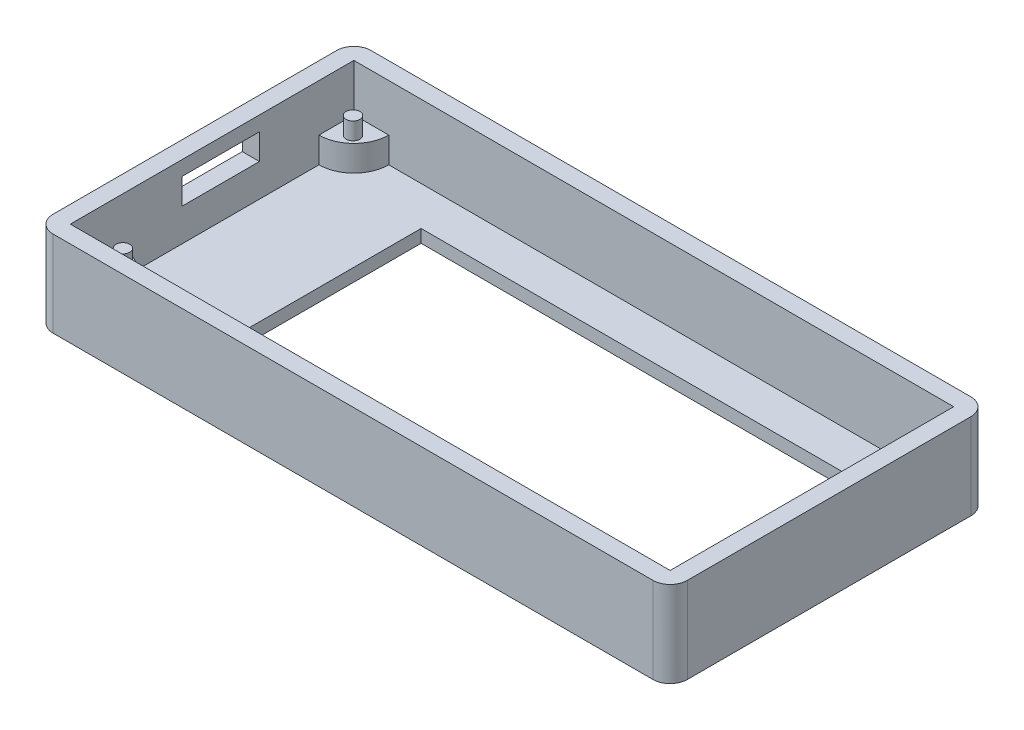
from build123d import *

# Parameters (mm, degrees)
EXTRUDE_1_DEPTH     = 1.5
CUT_EXTRUDE_2_REACH = 41.105
SKETCH_1_6_W        = 49.995
SKETCH_1_6_H        = 24.956
EXTRUDE_1_2_DEPTH   = 10
FILLET_1_R          = 2
EXTRUDE_2_DEPTH     = 3
SKETCH_3_R          = 0.8
EXTRUDE_3_DEPTH     = 2
CUT_EXTRUDE_3_REACH = 77.124
SKETCH_4_W          = 9
SKETCH_4_H          = 3


with BuildPart() as part:
    # 草图1 → Extrude 1 (new body)
    with BuildSketch(Plane(origin=(0, 0, 0), x_dir=(1, 0, 0), z_dir=(0, 1, 0))):
        Polygon((-34.925, 15.494), (34.925, 15.494), (34.925, -15.494), (34.925, -17.526), (-34.925, -17.526), (-34.925, -15.494), align=None)
    extrude(amount=EXTRUDE_1_DEPTH)

    # 草图1<6> → 切除-拉伸2 (cut, up to next)
    with BuildSketch(Plane(origin=(0, 0, 0), x_dir=(1, 0, 0), z_dir=(0, 1, 0)), mode=Mode.PRIVATE) as cut_extrude_2_sk1:
        with Locations((2.4365, -1.516)):
            Rectangle(SKETCH_1_6_W, SKETCH_1_6_H)
    cut_extrude_2_tool1 = extrude(cut_extrude_2_sk1.sketch, amount=CUT_EXTRUDE_2_REACH, mode=Mode.PRIVATE) & part.part
    add(cut_extrude_2_tool1.solids().sort_by_distance((2.4365, 0, 1.516))[0], mode=Mode.SUBTRACT)



with BuildPart() as body_2:
    # 草图1<7> → Extrude 1 2 (new body)
    with BuildSketch(Plane(origin=(0, 0, 0), x_dir=(1, 0, 0), z_dir=(0, 1, 0))):
        Polygon((36.925, -19.526), (-36.925, -19.526), (-36.925, -15.494), (-36.925, 17.494), (36.925, 17.494), (36.925, -15.494), align=None)
        Polygon((34.925, -17.526), (-34.925, -17.526), (-34.925, -15.494), (-34.925, 15.494), (34.925, 15.494), (34.925, -15.494), align=None, mode=Mode.SUBTRACT)
    extrude(amount=EXTRUDE_1_2_DEPTH)

    # 圆角1
    fillet_1_edges = [body_2.edges().sort_by_distance(p)[0] for p in [
        (36.925, 5, -17.494),
        (36.925, 5, 19.526),
        (-36.925, 5, 19.526),
        (-36.925, 5, -17.494),
    ]]
    fillet(fillet_1_edges, radius=FILLET_1_R)


with BuildPart() as part_1:
    add(part.part)

    add(body_2.part)  # 凸台-拉伸2 merges body 2
    # 草图2 → 凸台-拉伸2 (add)
    with BuildSketch(Plane(origin=(0, 1.5, 0), x_dir=(1, 0, 0), z_dir=(0, 1, 0))):
        with BuildLine():
            ThreePointArc((-31.405472759, -17.526), (-31.405472759, -13.462), (-34.925, -11.43))
            Line((-34.925, -11.43), (-34.925, -17.526))
            Line((-34.925, -17.526), (-31.405472759, -17.526))
        make_face()
        with BuildLine():
            Line((-34.925, 15.494), (-34.925, 11.43))
            ThreePointArc((-34.925, 11.43), (-32.051318041, 12.620318041), (-30.861, 15.494))
            Line((-30.861, 15.494), (-34.925, 15.494))
        make_face()
        with BuildLine():
            ThreePointArc((34.925, -11.43), (31.405472759, -13.462), (31.405472759, -17.526))
            Line((31.405472759, -17.526), (34.925, -17.526))
            Line((34.925, -17.526), (34.925, -11.43))
        make_face()
        with BuildLine():
            Line((34.925, 15.494), (30.861, 15.494))
            ThreePointArc((30.861, 15.494), (32.051318041, 12.620318041), (34.925, 11.43))
            Line((34.925, 11.43), (34.925, 15.494))
        make_face()
    extrude(amount=EXTRUDE_2_DEPTH)

    # 草图3 → 凸台-拉伸3 (add)
    with BuildSketch(Plane(origin=(0, 4.5, 0), x_dir=(1, 0, 0), z_dir=(0, 1, 0))):
        with Locations((-32.925, -13.394)):
            Circle(SKETCH_3_R)
        with Locations((-32.925, 13.394)):
            Circle(SKETCH_3_R)
        with Locations((32.925, -13.394)):
            Circle(SKETCH_3_R)
        with Locations((32.925, 13.394)):
            Circle(SKETCH_3_R)
    extrude(amount=EXTRUDE_3_DEPTH)

    # 草图4 → 切除-拉伸3 (cut, up to next)
    with BuildSketch(Plane(origin=(-34.925, 0, 0), x_dir=(0, 0, -1), z_dir=(1, 0, 0)), mode=Mode.PRIVATE) as cut_extrude_3_sk1:
        with Locations((0, 6.8)):
            Rectangle(SKETCH_4_W, SKETCH_4_H)
    cut_extrude_3_tool1 = extrude(cut_extrude_3_sk1.sketch, amount=-CUT_EXTRUDE_3_REACH, mode=Mode.PRIVATE) & part_1.part
    add(cut_extrude_3_tool1.solids().sort_by_distance((-34.925, 6.8, 0))[0], mode=Mode.SUBTRACT)


solid = part_1.part
